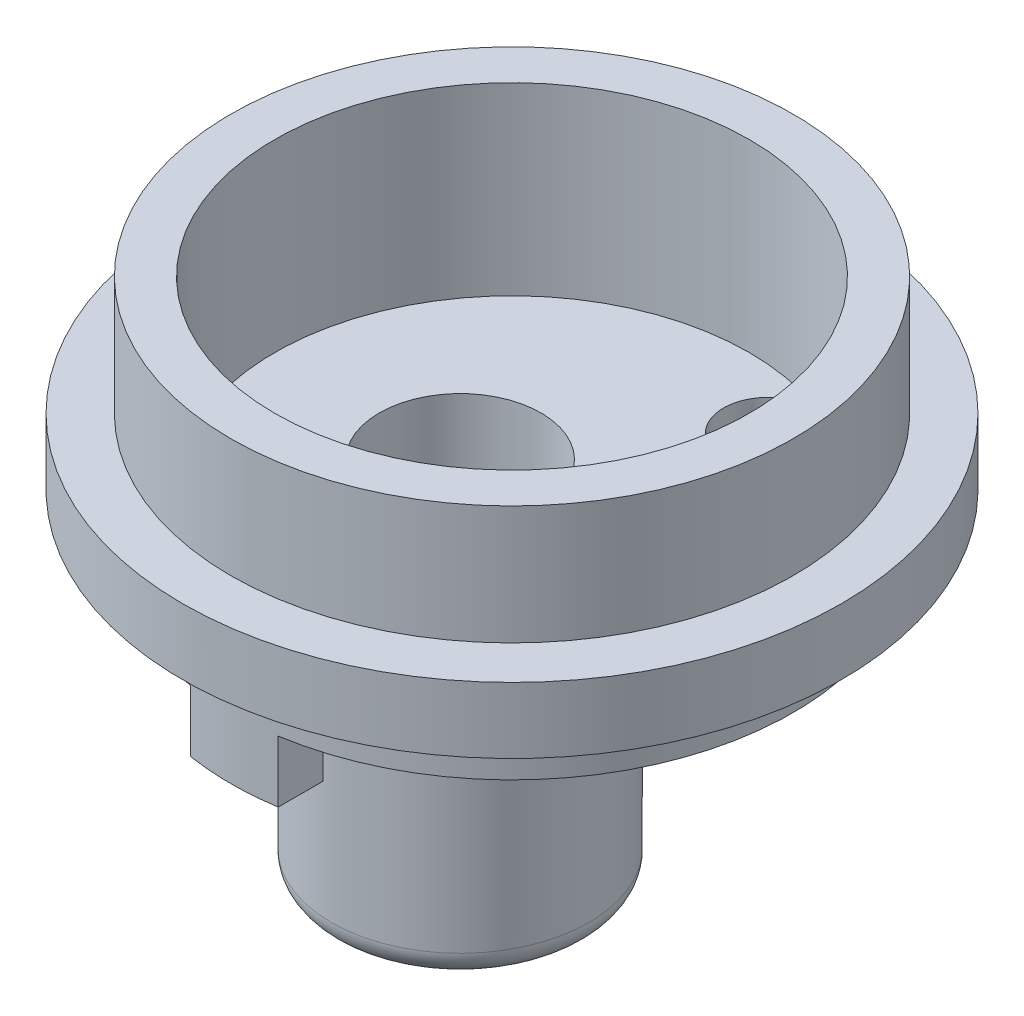
from build123d import *

# Parameters (mm, degrees)
SKETCH1_R              = 8.128
TOP_BODY_DEPTH         = 6.858
SKETCH2_R              = 5.08
ECCENTRIC_SLEEVE_DEPTH = 2.54
SKETCH3_R              = 3.724670389
ECCENTRIC_SHAFT_DEPTH  = 15.8242
SKETCH4_R              = 9.525
FLANGE_DEPTH           = 1.905
SKETCH5_R              = 6.858
TOP_HOLE_DEPTH         = 18.073240643
GROOVE_DEPTH           = 18.073240643
PINS_DEPTH             = 1.778
FILLET1_R              = 0.508
FILLET2_R              = 0.762


with BuildPart() as part:
    # Sketch1 → Top Body (new body)
    with BuildSketch(Plane(origin=(0, 0, 0), x_dir=(1, 0, 0), z_dir=(0, 1, 0))):
        with Locations(Location((0, 0, 0), (0, 0, 270))):
            Circle(SKETCH1_R)
    extrude(amount=TOP_BODY_DEPTH)

    # Sketch2 → Eccentric Sleeve (add)
    with BuildSketch(Plane.XZ):
        with Locations(Location((-1.4986, 0, 0), (0, 0, 90))):
            Circle(SKETCH2_R)
    extrude(amount=ECCENTRIC_SLEEVE_DEPTH)

    # Sketch3 → Eccentric Shaft (add)
    with BuildSketch(Plane(origin=(0, 6.858, 0), x_dir=(-1, 0, 0), z_dir=(0, 1, 0))):
        with Locations(Location((1.4986, 0, 0), (0, 0, 90))):
            Circle(SKETCH3_R)
    extrude(amount=-ECCENTRIC_SHAFT_DEPTH)

    # Sketch4 → Flange (add)
    with BuildSketch(Plane.XZ.offset(-1.524)):
        with Locations(Location((0, 0, 0), (0, 0, 270))):
            Circle(SKETCH4_R)
    extrude(amount=-FLANGE_DEPTH)

    # Sketch5 → Top Hole (cut, through all)
    with BuildSketch(Plane.XZ.offset(-1.524)):
        with Locations(Location((0, 0, 0), (0, 0, 270))):
            Circle(SKETCH5_R)
    extrude(amount=-TOP_HOLE_DEPTH, mode=Mode.SUBTRACT)

    # Sketch6 → Tapped Hole (revolve, cut)
    with BuildSketch(Plane.XY, mode=Mode.PRIVATE) as tapped_hole_sk:
        Polygon((0.8382, 1.524), (-1.4986, 1.524), (-1.4986, -8.9662), (0.4318, -8.9662), (0.4318, -6.859631692), (0.8382, -3.81), align=None)
    revolve(tapped_hole_sk.sketch.rotate(Axis((-1.4986, 5.365186462, 0), (0, -1, 0)), 180), axis=Axis((-1.4986, 5.365186462, 0), (0, -1, 0)), mode=Mode.SUBTRACT)

    # Sketch7 → Groove (cut, through all)
    with BuildSketch(Plane(origin=(0, 1.524, 0), x_dir=(-1, 0, 0), z_dir=(0, 1, 0))):
        with BuildLine():
            ThreePointArc((-2.805281279, 6.257999756), (-6.858, 0), (-2.805281279, -6.257999756))
            ThreePointArc((-2.805281279, -6.257999756), (-1.189982392, -5.741074463), (-1.528907797, -4.07928873))
            ThreePointArc((-1.528907797, -4.07928873), (-3.5814, 0), (-1.528907797, 4.07928873))
            ThreePointArc((-1.528907797, 4.07928873), (-1.189982392, 5.741074463), (-2.805281279, 6.257999756))
        make_face()
    extrude(amount=-GROOVE_DEPTH, mode=Mode.SUBTRACT)

    # Sketch8 → Pins (add)
    with BuildSketch(Plane.XZ):
        with BuildLine():
            Line((-1.27, 8.02816816), (-1.27, 6.739381574))
            ThreePointArc((-1.27, 6.739381574), (0, 6.858), (1.27, 6.739381574))
            Line((1.27, 6.739381574), (1.27, 8.02816816))
            ThreePointArc((1.27, 8.02816816), (0, 8.128), (-1.27, 8.02816816))
        make_face()
        with BuildLine():
            Line((1.27, -6.739381574), (1.27, -8.02816816))
            ThreePointArc((1.27, -8.02816816), (0, -8.128), (-1.27, -8.02816816))
            Line((-1.27, -8.02816816), (-1.27, -6.739381574))
            ThreePointArc((-1.27, -6.739381574), (0, -6.858), (1.27, -6.739381574))
        make_face()
    extrude(amount=PINS_DEPTH)

    # Fillet1
    # the kernel refuses this fillet: 0.508 mm, written as the material it takes off along each edge
    with BuildSketch(Plane(origin=(2.285784746, 0, -5.099110912), x_dir=(0.40905238828967766, 0, -0.9125109005565417), z_dir=(0.9125109005565417, 0, 0.40905238828967766))) as fillet1_piece_1_section:
        with BuildLine():
            CenterArc((1.27 + FILLET1_R, FILLET1_R), FILLET1_R, 180, 90)
            Line((1.27, FILLET1_R), (1.27, 0))
            Line((1.27, 0), (1.27 + FILLET1_R, 0))
        make_face()
    fillet1_piece_1 = revolve(axis=Axis((2.285784746, 0, -5.099110912), (0, 1, 0)), revolution_arc=224.939404777, mode=Mode.PRIVATE)
    fillet1_piece_1 = fillet1_piece_1 - Plane(origin=(-1.4986, 0.082765889, 0), x_dir=(0, 0, 1), z_dir=(0, 1, 0)) * Cylinder(5.08, 8, mode=Mode.PRIVATE)
    add(fillet1_piece_1, mode=Mode.SUBTRACT)
    with BuildSketch(Plane(origin=(0, 0, 0), x_dir=(0.40905238828967727, 0, 0.9125109005565418), z_dir=(-0.9125109005565418, 0, 0.40905238828967727))) as fillet1_piece_2:
        with BuildLine():
            CenterArc((6.858 + FILLET1_R, FILLET1_R), FILLET1_R, 180, 90)
            Line((6.858, FILLET1_R), (6.858, 0))
            Line((6.858, 0), (6.858 + FILLET1_R, 0))
        make_face()
    revolve(axis=Axis((0, 0, 0), (0, 1, 0)), revolution_arc=131.709357588, mode=Mode.SUBTRACT)
    with BuildSketch(Plane(origin=(2.285784746, 0, 5.099110912), x_dir=(0.355010429323337, 0, -0.9348623401718886), z_dir=(0.9348623401718886, 0, 0.355010429323337))) as fillet1_piece_3_section:
        with BuildLine():
            CenterArc((1.27 + FILLET1_R, FILLET1_R), FILLET1_R, 180, 90)
            Line((1.27, FILLET1_R), (1.27, 0))
            Line((1.27, 0), (1.27 + FILLET1_R, 0))
        make_face()
    fillet1_piece_3 = revolve(axis=Axis((2.285784746, 0, 5.099110912), (0, 1, 0)), revolution_arc=224.939404777, mode=Mode.PRIVATE)
    fillet1_piece_3 = fillet1_piece_3 - Plane(origin=(-1.4986, 0.254, 0), x_dir=(0, 0, 1), z_dir=(0, 1, 0)) * Cylinder(5.08, 8, mode=Mode.PRIVATE)
    add(fillet1_piece_3, mode=Mode.SUBTRACT)

    # Fillet2
    fillet2_edges = [part.edges().sort_by_distance(p)[0] for p in [
        (-1.4986, -8.9662, -3.724670389),
    ]]
    fillet(fillet2_edges, radius=FILLET2_R)


solid = part.part
